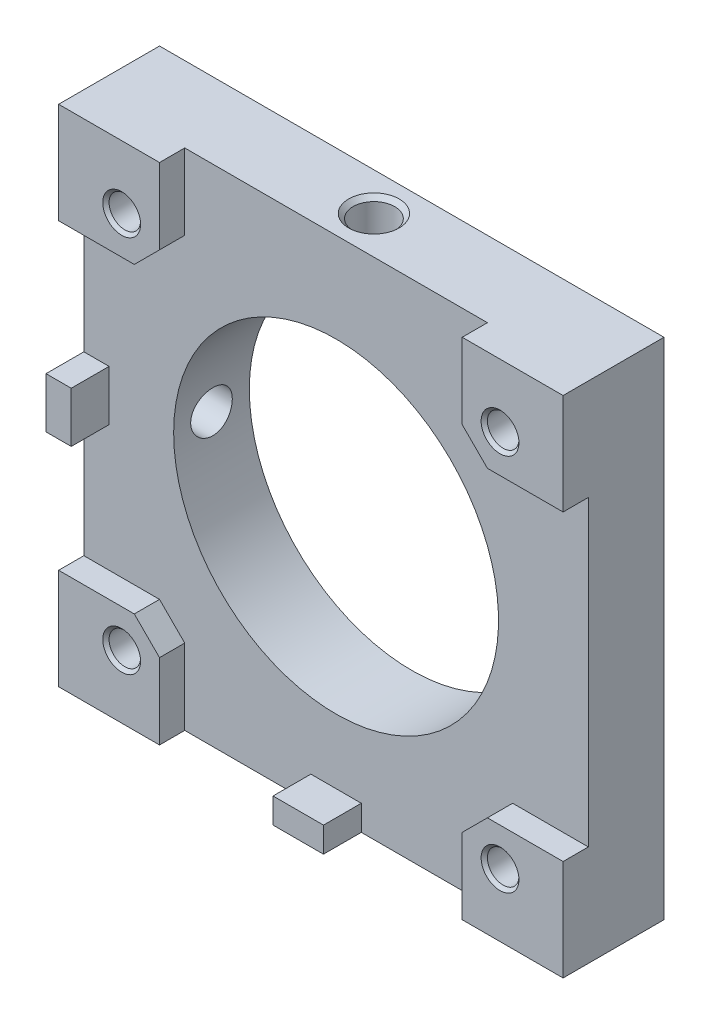
from build123d import *

# Parameters (mm, degrees)
SKETCH1_W                       = 40
SKETCH1_H                       = 40
BOSS_EXTRUDE1_DEPTH             = 4
M3X0_5_TAPPED_HOLE1_D           = 2.5
M3X0_5_TAPPED_HOLE1_CSINK_D     = 3
M3X0_5_TAPPED_HOLE1_CSINK_ANGLE = 90
CUT_EXTRUDE1_DEPTH              = 2
CHAMFER1_SIZE                   = 2
SKETCH7_W                       = 2
SKETCH7_H                       = 4
SKETCH7_W_2                     = 4
SKETCH7_H_2                     = 2
BOSS_EXTRUDE2_DEPTH             = 3
SKETCH12_R                      = 12.88
CUT_EXTRUDE2_DEPTH              = 30.681644159


# Read off the part's stored shape, not the designer's step: M4x0.7 Tapped Hole1, M4x0.7 Tapped Hole2
with BuildPart() as part:
    # Sketch1 → Boss-Extrude1 (new, symmetric)
    with BuildSketch(Plane.XY):
        Rectangle(SKETCH1_W, SKETCH1_H)
    extrude(amount=BOSS_EXTRUDE1_DEPTH, both=True)

    # M3x0.5 Tapped Hole1 (through all)
    with Locations(Plane.XY.offset(4)):
        with Locations((-15, 15), (15, 15), (15, -15), (-15, -15)):
            CounterSinkHole(M3X0_5_TAPPED_HOLE1_D / 2, M3X0_5_TAPPED_HOLE1_CSINK_D / 2, counter_sink_angle=M3X0_5_TAPPED_HOLE1_CSINK_ANGLE)

    # Sketch6 → Cut-Extrude1 (cut)
    with BuildSketch(Plane.XY.offset(4)):
        Polygon((-20, 12), (-12, 12), (-12, 20), (12, 20), (12, 12), (20, 12), (20, -12), (12, -12), (12, -20), (-12, -20), (-12, -12), (-20, -12), align=None)
    extrude(amount=-CUT_EXTRUDE1_DEPTH, mode=Mode.SUBTRACT)

    # Chamfer1
    chamfer1_edges = [part.edges().sort_by_distance(p)[0] for p in [
        (-12, 12, 3),
        (12, 12, 3),
        (12, -12, 3),
        (-12, -12, 3),
    ]]
    chamfer(chamfer1_edges, length=CHAMFER1_SIZE)

    # Sketch7 → Boss-Extrude2 (add)
    with BuildSketch(Plane.XY.offset(2)):
        with Locations((-19, 0)):
            Rectangle(SKETCH7_W, SKETCH7_H)
        with Locations((0, -19)):
            Rectangle(SKETCH7_W_2, SKETCH7_H_2)
    extrude(amount=BOSS_EXTRUDE2_DEPTH)

    # Sketch12 → Cut-Extrude2 (cut, through all)
    with BuildSketch(Plane(origin=(0, 0, -4), x_dir=(-1, 0, 0), z_dir=(0, 0, -1))):
        Circle(SKETCH12_R)
    extrude(amount=-CUT_EXTRUDE2_DEPTH, mode=Mode.SUBTRACT)

    # M4x0.7 Tapped Hole1 outline → M4x0.7 Tapped Hole1 (revolve, cut)
    with BuildSketch(Plane.XY.offset(-1)):
        Polygon((0, 12.773860334), (1.65, 12.773860334), (1.65, 19.65), (2, 20), (0, 20), align=None)
    revolve(axis=Axis((0, 0, -1), (0, 1, 0)), mode=Mode.SUBTRACT)

    # M4x0.7 Tapped Hole2 outline → M4x0.7 Tapped Hole2 (revolve, cut)
    with BuildSketch(Plane.YX.offset(1)):
        Polygon((1.65, -19.65), (1.65, -12.773829877), (0, -12.773829877), (0, -20), (2, -20), align=None)
    revolve(axis=Axis((0, 0, -1), (1, 0, 0)), mode=Mode.SUBTRACT)


solid = part.part
